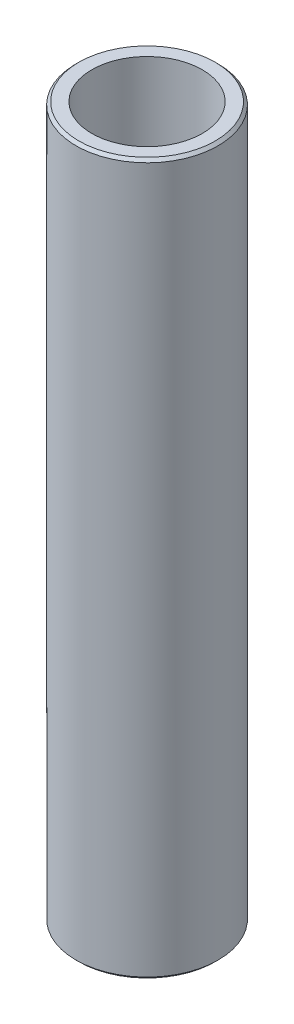
from build123d import *

# Parameters (mm, degrees)
SKETCH1_R           = 37.5
BOSS_EXTRUDE1_DEPTH = 375.319432727
SKETCH2_R           = 29.178578253
CUT_EXTRUDE1_DEPTH  = 380.047723357
CHAMFER1_SIZE       = 1.479843998


with BuildPart() as part:
    # Sketch1 → Boss-Extrude1 (new body)
    with BuildSketch(Plane(origin=(0, 0, 0), x_dir=(1, 0, 0), z_dir=(0, 1, 0))):
        Circle(SKETCH1_R)
    extrude(amount=BOSS_EXTRUDE1_DEPTH)

    # Sketch2 → Cut-Extrude1 (cut, through all)
    with BuildSketch(Plane(origin=(0, 0, 0), x_dir=(1, 0, 0), z_dir=(0, 1, 0))):
        Circle(SKETCH2_R)
    extrude(amount=CUT_EXTRUDE1_DEPTH, mode=Mode.SUBTRACT)

    # Chamfer1
    chamfer1_edges = [part.edges().sort_by_distance(p)[0] for p in [
        (-37.5, 375.319432727, 0),
        (-37.5, 0, 0),
    ]]
    chamfer(chamfer1_edges, length=CHAMFER1_SIZE)


solid = part.part
